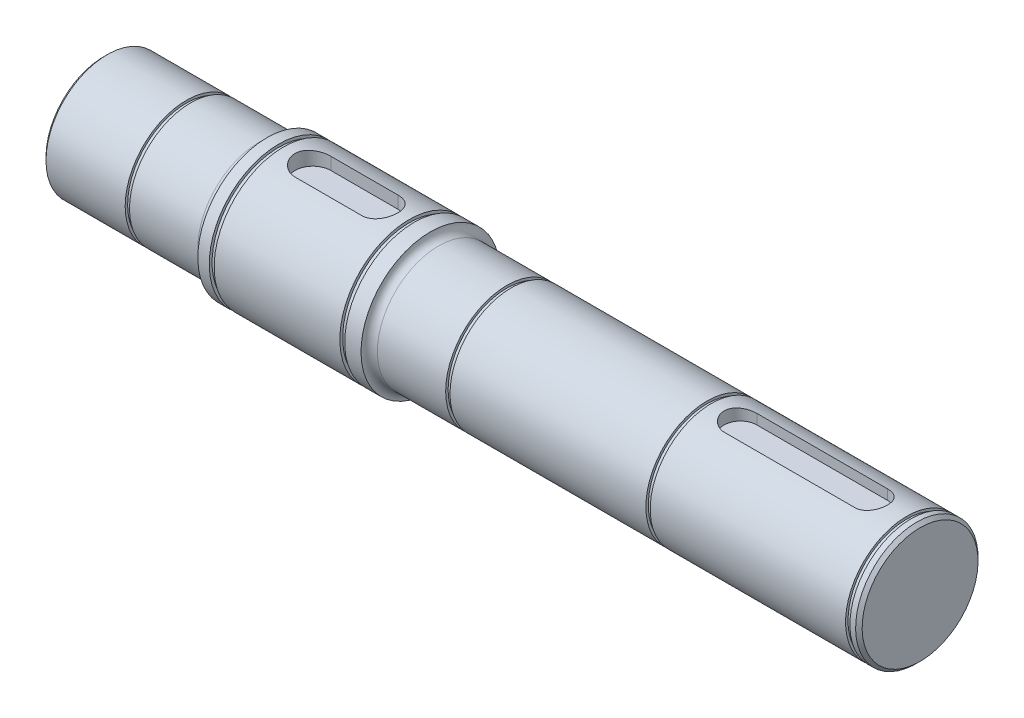
from build123d import *

# Parameters (mm, degrees)
ESQUISSE2_R              = 42.5
ESQUISSE2_R_2            = 40.75
ENL_V_MAT_EXTRU_1_DEPTH  = 3
ESQUISSE3_R              = 42.5
ESQUISSE3_R_2            = 40.75
ENL_V_MAT_EXTRU_2_DEPTH  = 3
ENL_V_MAT_EXTRU_3_DEPTH  = 9
ENL_V_MAT_EXTRU_4_DEPTH  = 7.5
CHANFREIN1_SIZE          = 2
ESQUISSE6_R              = 37.5
ESQUISSE6_R_2            = 36
ENL_V_MAT_EXTRU_5_DEPTH  = 2.65
ENL_V_START              = -2.65
ESQUISSE7_R              = 37.5
ESQUISSE7_R_2            = 36
ENL_V_MAT_EXTRU_6_DEPTH  = 2.65
ESQUISSE8_R              = 37.5
ESQUISSE8_R_2            = 36
ENL_V_MAT_EXTRU_7_DEPTH  = 2.65
ENL_V_START_2            = 2.65
ESQUISSE10_R             = 37.5
ESQUISSE10_R_2           = 36
ENL_V_MAT_EXTRU_11_DEPTH = 2.65


with BuildPart() as part:
    # Esquisse1 → Révolution1 (revolve)
    with BuildSketch(Plane.XY):
        with BuildLine():
            Line((0, 0), (0, 37.5))
            Line((0, 37.5), (95, 37.5))
            ThreePointArc((95, 37.5), (98.535533906, 38.964466094), (100, 42.5))
            Line((100, 42.5), (200, 42.5))
            ThreePointArc((200, 42.5), (201.464466094, 38.964466094), (205, 37.5))
            Line((205, 37.5), (500, 37.5))
            Line((500, 37.5), (500, 0))
            Line((500, 0), (0, 0))
        make_face()
    revolve(axis=Axis((500, 0, 0), (-1, 0, 0)))

    # Esquisse2 → Enlèv. mat.-Extru.1 (cut)
    with BuildSketch(Plane(origin=(110, 0, 0), x_dir=(0, 0, -1), z_dir=(1, 0, 0))):
        Circle(ESQUISSE2_R)
        Circle(ESQUISSE2_R_2, mode=Mode.SUBTRACT)
    extrude(amount=-ENL_V_MAT_EXTRU_1_DEPTH, mode=Mode.SUBTRACT)

    # Esquisse3 → Enlèv. mat.-Extru.2 (cut)
    with BuildSketch(Plane(origin=(190, 0, 0), x_dir=(0, 0, -1), z_dir=(1, 0, 0))):
        Circle(ESQUISSE3_R)
        Circle(ESQUISSE3_R_2, mode=Mode.SUBTRACT)
    extrude(amount=-ENL_V_MAT_EXTRU_2_DEPTH, mode=Mode.SUBTRACT)

    # Esquisse4 → Enlèv. mat.-Extru.3 (cut)
    with BuildSketch(Plane(origin=(0, 42.5, 0), x_dir=(1, 0, 0), z_dir=(0, 1, 0))):
        with BuildLine():
            Line((128, 11), (169, 11))
            ThreePointArc((169, 11), (180, 0), (169, -11))
            Line((169, -11), (128, -11))
            ThreePointArc((128, -11), (117, 0), (128, 11))
        make_face()
    extrude(amount=-ENL_V_MAT_EXTRU_3_DEPTH, mode=Mode.SUBTRACT)

    # Esquisse5 → Enlèv. mat.-Extru.4 (cut)
    with BuildSketch(Plane(origin=(0, 37.5, 0), x_dir=(1, 0, 0), z_dir=(0, 1, 0))):
        with BuildLine():
            Line((470, -10), (390, -10))
            ThreePointArc((390, -10), (380, 0), (390, 10))
            Line((390, 10), (470, 10))
            ThreePointArc((470, 10), (480, 0), (470, -10))
        make_face()
    extrude(amount=-ENL_V_MAT_EXTRU_4_DEPTH, mode=Mode.SUBTRACT)

    # Chanfrein1
    chanfrein1_edges = [part.edges().sort_by_distance(p)[0] for p in [
        (500, -37.5, 0),
        (0, -37.5, 0),
    ]]
    chamfer(chanfrein1_edges, length=CHANFREIN1_SIZE)

    # Esquisse6 → Enlèv. mat.-Extru.5 (cut)
    with BuildSketch(Plane(origin=(494.5, 0, 0), x_dir=(0, 0, -1), z_dir=(1, 0, 0))):
        Circle(ESQUISSE6_R)
        Circle(ESQUISSE6_R_2, mode=Mode.SUBTRACT)
    extrude(amount=-ENL_V_MAT_EXTRU_5_DEPTH, mode=Mode.SUBTRACT)

    # Esquisse7 → Enlèv. mat.-Extru.6 (cut)
    with BuildSketch(Plane.ZY.offset(-50.5).offset(ENL_V_START)):
        Circle(ESQUISSE7_R)
        Circle(ESQUISSE7_R_2, mode=Mode.SUBTRACT)
    extrude(amount=ENL_V_MAT_EXTRU_6_DEPTH, mode=Mode.SUBTRACT)

    # Esquisse8 → Enlèv. mat.-Extru.7 (cut)
    with BuildSketch(Plane.ZY.offset(-249.5)):
        Circle(ESQUISSE8_R)
        Circle(ESQUISSE8_R_2, mode=Mode.SUBTRACT)
    extrude(amount=ENL_V_MAT_EXTRU_7_DEPTH, mode=Mode.SUBTRACT)

    # Esquisse10 → Enlèv. mat.-Extru.11 (cut)
    with BuildSketch(Plane(origin=(369.5, 0, 0), x_dir=(0, 0, -1), z_dir=(1, 0, 0)).offset(ENL_V_START_2)):
        Circle(ESQUISSE10_R)
        Circle(ESQUISSE10_R_2, mode=Mode.SUBTRACT)
    extrude(amount=-ENL_V_MAT_EXTRU_11_DEPTH, mode=Mode.SUBTRACT)


solid = part.part
